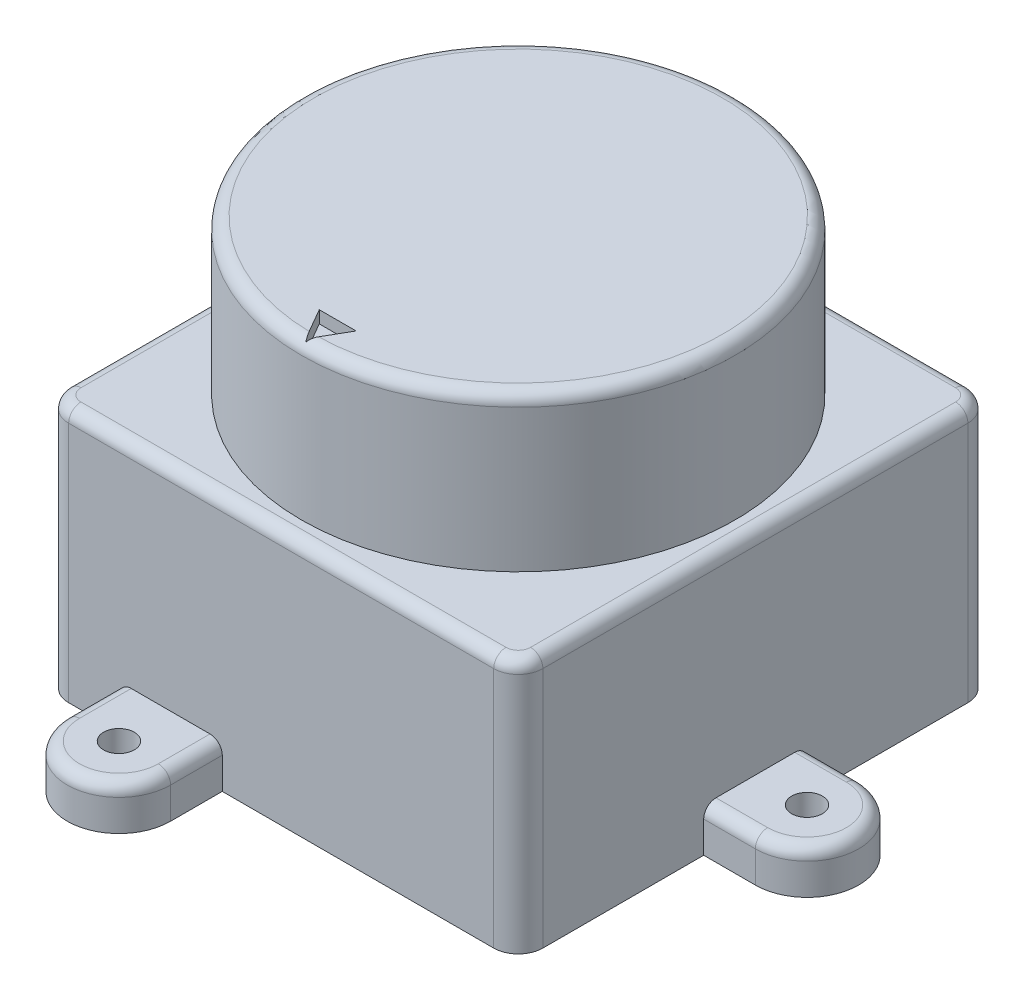
from build123d import *

# Parameters (mm, degrees)
SKETCH1_W           = 38.59
SKETCH1_H           = 38.59
BOSS_EXTRUDE1_DEPTH = 20.7
SKETCH2_R           = 17.645
BOSS_EXTRUDE2_DEPTH = 12.6
CUT_EXTRUDE1_DEPTH  = 1
SKETCH6_W           = 8
SKETCH6_H           = 4
CUT_EXTRUDE2_DEPTH  = 4
SKETCH8_R           = 4.205
SKETCH8_R_2         = 1.25
BOSS_EXTRUDE3_DEPTH = 3.55
FILLET2_R           = 2
FILLET1_R           = 1


with BuildPart() as part:
    # Sketch1 → Boss-Extrude1 (new body)
    with BuildSketch(Plane(origin=(0, 0, 0), x_dir=(1, 0, 0), z_dir=(0, 1, 0))):
        with Locations((19.295, 19.295)):
            Rectangle(SKETCH1_W, SKETCH1_H)
    extrude(amount=BOSS_EXTRUDE1_DEPTH)

    # Sketch2 → Boss-Extrude2 (add)
    with BuildSketch(Plane(origin=(0, 20.7, 0), x_dir=(1, 0, 0), z_dir=(0, 1, 0))):
        with Locations(Location((19.295, 19.295, 0), (0, 0, 270))):
            Circle(SKETCH2_R)
    extrude(amount=BOSS_EXTRUDE2_DEPTH)

    # Sketch3 → Cut-Extrude1 (cut)
    with BuildSketch(Plane(origin=(0, 33.3, 0), x_dir=(1, 0, 0), z_dir=(0, 1, 0))):
        Polygon((17.795, 4.598076211), (19.295, 2), (20.795, 4.598076211), align=None)
    extrude(amount=-CUT_EXTRUDE1_DEPTH, mode=Mode.SUBTRACT)

    # Sketch6 → Cut-Extrude2 (cut)
    with BuildSketch(Plane(origin=(0, 0, 0), x_dir=(0, 0, -1), z_dir=(1, 0, 0))):
        with Locations((19.295, 3)):
            Rectangle(SKETCH6_W, SKETCH6_H)
    extrude(amount=CUT_EXTRUDE2_DEPTH, mode=Mode.SUBTRACT)

    # Sketch8 → Boss-Extrude3 (add)
    # profile 1 of 9: a face of its own
    with BuildSketch(Plane.XZ):
        with BuildLine():
            ThreePointArc((10.294999977, 0), (7.321615977, 1.231615993), (6.09, 4.205))
            Line((6.09, 4.205), (6.09, 0))
            Line((6.09, 0), (10.294999977, 0))
        make_face()
    # profile 2 of 9: a face of its own
    with BuildSketch(Plane.XZ):
        with BuildLine():
            Line((14.5, 0), (14.5, 4.205))
            ThreePointArc((14.5, 4.205), (13.268384007, 1.231615977), (10.294999977, 0))
            Line((10.294999977, 0), (14.5, 0))
        make_face()
    # profile 3 of 9: a face of its own
    with BuildSketch(Plane.XZ):
        with Locations((10.295, 4.205)):
            Circle(SKETCH8_R)
        with Locations(Location((10.295, 4.205, 0), (0, 0, 270))):
            Circle(SKETCH8_R_2, mode=Mode.SUBTRACT)
    # profile 4 of 9: a face of its own
    with BuildSketch(Plane.XZ):
        with BuildLine():
            Line((42.795, -15.09), (38.59, -15.09))
            Line((38.59, -15.09), (38.59, -19.295))
            ThreePointArc((38.59, -19.295), (39.821615985, -16.321615985), (42.795, -15.09))
        make_face()
    # profile 5 of 9: a face of its own
    with BuildSketch(Plane.XZ):
        with BuildLine():
            ThreePointArc((42.795, -23.5), (39.821615985, -22.268384015), (38.59, -19.295))
            Line((38.59, -19.295), (38.59, -23.5))
            Line((38.59, -23.5), (42.795, -23.5))
        make_face()
    # profile 6 of 9: a face of its own
    with BuildSketch(Plane.XZ):
        with Locations((42.795, -19.295)):
            Circle(SKETCH8_R)
        with Locations(Location((42.795, -19.295, 0), (0, 0, 270))):
            Circle(SKETCH8_R_2, mode=Mode.SUBTRACT)
    # profile 7 of 9: a face of its own
    with BuildSketch(Plane.XZ):
        with BuildLine():
            ThreePointArc((6.09, -42.795), (7.321615985, -39.821615985), (10.295, -38.59))
            Line((10.295, -38.59), (6.09, -38.59))
            Line((6.09, -38.59), (6.09, -42.795))
        make_face()
    # profile 8 of 9: a face of its own
    with BuildSketch(Plane.XZ):
        with Locations((10.295, -42.795)):
            Circle(SKETCH8_R)
        with Locations(Location((10.295, -42.795, 0), (0, 0, 270))):
            Circle(SKETCH8_R_2, mode=Mode.SUBTRACT)
    # profile 9 of 9: a face of its own
    with BuildSketch(Plane.XZ):
        with BuildLine():
            Line((14.5, -42.795), (14.5, -38.59))
            Line((14.5, -38.59), (10.295, -38.59))
            ThreePointArc((10.295, -38.59), (13.268384015, -39.821615985), (14.5, -42.795))
        make_face()
    extrude(amount=-BOSS_EXTRUDE3_DEPTH)

    # Fillet2
    fillet2_edges = [part.edges().sort_by_distance(p)[0] for p in [
        (0, 10.35, -38.59),
        (38.59, 10.35, -38.59),
        (38.59, 10.35, 0),
        (0, 10.35, 0),
    ]]
    fillet(fillet2_edges, radius=FILLET2_R)

    # Fillet1
    # the kernel refuses this fillet: 1 mm, written as the material it takes off along each edge
    with BuildSketch(Plane(origin=(2, 20.7, -36.59), x_dir=(-1, 0, 0), z_dir=(0, 0, 1))) as fillet1_piece_1:
        with BuildLine():
            CenterArc((2 - FILLET1_R, FILLET1_R), FILLET1_R, 270, 90)
            Line((2, FILLET1_R), (2, 0))
            Line((2, 0), (2 - FILLET1_R, 0))
        make_face()
    revolve(axis=Axis((2, 20.7, -36.59), (0, -1, 0)), revolution_arc=90, mode=Mode.SUBTRACT)
    with BuildSketch(Plane(origin=(19.295, 33.3, -19.295), x_dir=(0, 0, 1), z_dir=(-1, 0, 0))) as fillet1_piece_2:
        with BuildLine():
            CenterArc((17.645 - FILLET1_R, -FILLET1_R), FILLET1_R, 0, 90)
            Line((17.645 - FILLET1_R, 0), (17.645, 0))
            Line((17.645, 0), (17.645, -FILLET1_R))
        make_face()
    revolve(axis=Axis((19.295, 33.3, -19.295), (0, 1, 0)), mode=Mode.SUBTRACT)
    with BuildSketch(Plane(origin=(6.09, 3.55, 4.205), x_dir=(0, -1, 0), z_dir=(0, 0, -1)), Plane(origin=(42.795, 3.55, -15.09), x_dir=(0, -1, 0), z_dir=(-1, 0, 0)), Plane(origin=(38.59, 3.55, -23.5), x_dir=(0, -1, 0), z_dir=(1, 0, 0)), Plane(origin=(6.09, 3.55, -38.59), x_dir=(0, -1, 0), z_dir=(0, 0, -1)), Plane(origin=(14.5, 3.55, -42.795), x_dir=(0, -1, 0), z_dir=(0, 0, 1))) as fillet1_piece_3:
        with BuildLine():
            CenterArc((FILLET1_R, -FILLET1_R), FILLET1_R, 90, 90)
            Line((0, -FILLET1_R), (0, 0))
            Line((0, 0), (FILLET1_R, 0))
        make_face()
    extrude(amount=4.205, mode=Mode.SUBTRACT)
    with BuildSketch(Plane(origin=(10.295, 3.55, 4.205), x_dir=(1, 0, 0), z_dir=(0, 0, -1))) as fillet1_piece_4:
        with BuildLine():
            CenterArc((4.205 - FILLET1_R, FILLET1_R), FILLET1_R, 270, 90)
            Line((4.205, FILLET1_R), (4.205, 0))
            Line((4.205, 0), (4.205 - FILLET1_R, 0))
        make_face()
    revolve(axis=Axis((10.295, 3.55, 4.205), (0, -1, 0)), revolution_arc=180, mode=Mode.SUBTRACT)
    with BuildSketch(Plane(origin=(14.5, 3.55, 0), x_dir=(-1, 0, 0), z_dir=(0, 0, 1))) as fillet1_piece_5:
        with BuildLine():
            CenterArc((FILLET1_R, FILLET1_R), FILLET1_R, 180, 90)
            Line((0, FILLET1_R), (0, 0))
            Line((0, 0), (FILLET1_R, 0))
        make_face()
    extrude(amount=4.205, mode=Mode.SUBTRACT)
    with BuildSketch(Plane(origin=(42.795, 3.55, -19.295), x_dir=(0, 0, -1), z_dir=(-1, 0, 0))) as fillet1_piece_6:
        with BuildLine():
            CenterArc((4.205 - FILLET1_R, FILLET1_R), FILLET1_R, 270, 90)
            Line((4.205 - FILLET1_R, 0), (4.205, 0))
            Line((4.205, 0), (4.205, FILLET1_R))
        make_face()
    revolve(axis=Axis((42.795, 3.55, -19.295), (0, -1, 0)), revolution_arc=180, mode=Mode.SUBTRACT)
    with BuildSketch(Plane(origin=(10.295, 3.55, -42.795), x_dir=(-1, 0, 0), z_dir=(0, 0, 1))) as fillet1_piece_7:
        with BuildLine():
            CenterArc((4.205 - FILLET1_R, FILLET1_R), FILLET1_R, 270, 90)
            Line((4.205 - FILLET1_R, 0), (4.205, 0))
            Line((4.205, 0), (4.205, FILLET1_R))
        make_face()
    revolve(axis=Axis((10.295, 3.55, -42.795), (0, -1, 0)), revolution_arc=180, mode=Mode.SUBTRACT)
    with BuildSketch(Plane(origin=(0, 20.7, -36.59), x_dir=(1, 0, 0), z_dir=(0, 0, 1)), Plane(origin=(36.59, 20.7, -38.59), x_dir=(0, 0, 1), z_dir=(-1, 0, 0)), Plane(origin=(38.59, 20.7, -2), x_dir=(-1, 0, 0), z_dir=(0, 0, -1))) as fillet1_piece_8:
        with BuildLine():
            CenterArc((FILLET1_R, -FILLET1_R), FILLET1_R, 90, 90)
            Line((0, -FILLET1_R), (0, 0))
            Line((0, 0), (FILLET1_R, 0))
        make_face()
    extrude(amount=34.59, mode=Mode.SUBTRACT)
    with BuildSketch(Plane(origin=(2, 20.7, 0), x_dir=(0, -1, 0), z_dir=(1, 0, 0))) as fillet1_piece_9:
        with BuildLine():
            CenterArc((FILLET1_R, FILLET1_R), FILLET1_R, 180, 90)
            Line((0, FILLET1_R), (0, 0))
            Line((0, 0), (FILLET1_R, 0))
        make_face()
    extrude(amount=34.59, mode=Mode.SUBTRACT)
    with BuildSketch(Plane(origin=(2, 20.7, -2), x_dir=(0, 0, 1), z_dir=(1, 0, 0))) as fillet1_piece_10:
        with BuildLine():
            CenterArc((2 - FILLET1_R, FILLET1_R), FILLET1_R, 270, 90)
            Line((2 - FILLET1_R, 0), (2, 0))
            Line((2, 0), (2, FILLET1_R))
        make_face()
    revolve(axis=Axis((2, 20.7, -2), (0, -1, 0)), revolution_arc=90, mode=Mode.SUBTRACT)
    with BuildSketch(Plane(origin=(36.59, 20.7, -2), x_dir=(0, 0, 1), z_dir=(-1, 0, 0))) as fillet1_piece_11:
        with BuildLine():
            CenterArc((2 - FILLET1_R, -FILLET1_R), FILLET1_R, 0, 90)
            Line((2, -FILLET1_R), (2, 0))
            Line((2, 0), (2 - FILLET1_R, 0))
        make_face()
    revolve(axis=Axis((36.59, 20.7, -2), (0, 1, 0)), revolution_arc=90, mode=Mode.SUBTRACT)
    with BuildSketch(Plane(origin=(36.59, 20.7, -36.59), x_dir=(1, 0, 0), z_dir=(0, 0, 1))) as fillet1_piece_12:
        with BuildLine():
            CenterArc((2 - FILLET1_R, -FILLET1_R), FILLET1_R, 0, 90)
            Line((2, -FILLET1_R), (2, 0))
            Line((2, 0), (2 - FILLET1_R, 0))
        make_face()
    revolve(axis=Axis((36.59, 20.7, -36.59), (0, 1, 0)), revolution_arc=90, mode=Mode.SUBTRACT)


solid = part.part
